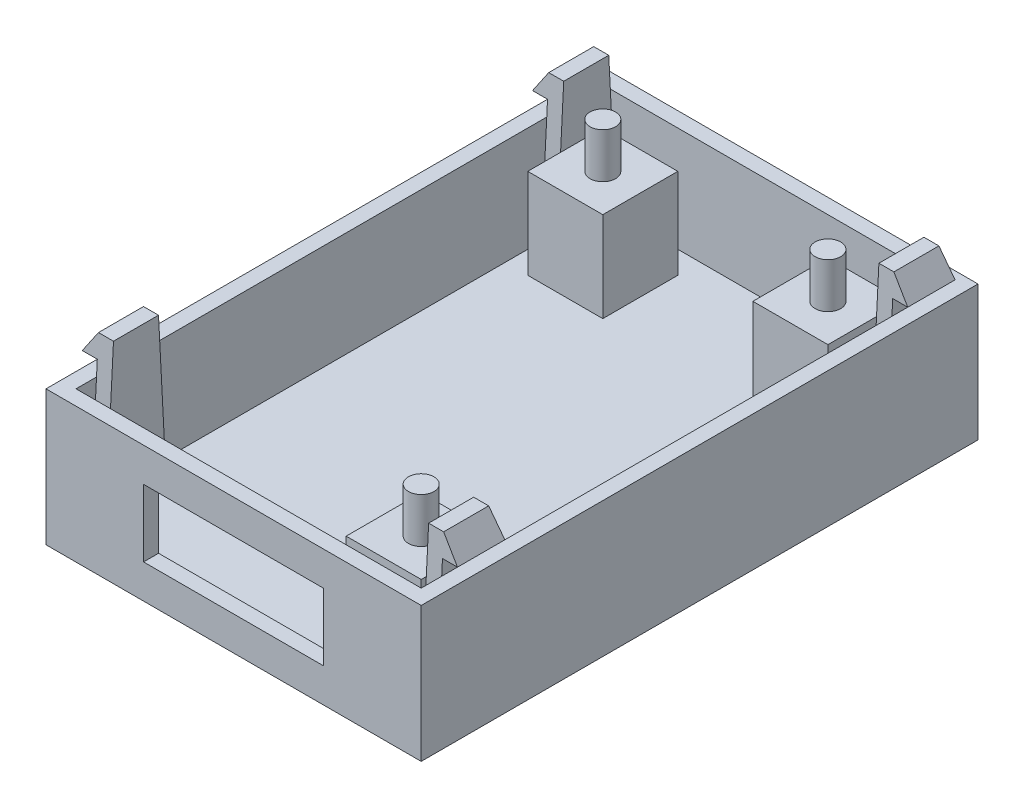
from build123d import *

# Parameters (mm, degrees)
SKETCH2_W           = 25
SKETCH2_H           = 37.1
BOSS_EXTRUDE2_DEPTH = 2
SKETCH2_9_W         = 5
SKETCH2_9_H         = 5
SKETCH2_9_R         = 0.85
BOSS_EXTRUDE4_DEPTH = 6
SKETCH2_10_W        = 25
SKETCH2_10_H        = 37.1
SKETCH2_10_W_2      = 23
SKETCH2_10_H_2      = 35.1
BOSS_EXTRUDE5_DEPTH = 7
SNAP_START          = 1
SNAP_HOOK1_DEPTH    = 1
SNAP_START_2        = 1.525191878
SNAP_HOOK1_2_DEPTH  = 3.157223338
SNAP_START_3        = -1
SNAP_HOOK1_3_DEPTH  = 2
SNAP_HOOK1_4_DEPTH  = 1
LPATTERN1_START     = 1
LPATTERN1_DEPTH     = 1
LPATTERN1_START_2   = 31.525191878
LPATTERN1_2_DEPTH   = 3.157223338
LPATTERN1_START_3   = -1
LPATTERN1_3_DEPTH   = 2
LPATTERN1_4_DEPTH   = 1
SKETCH2_11_R        = 0.85
BOSS_EXTRUDE7_DEPTH = 9
SKETCH9_W           = 12
SKETCH9_H           = 4.478730726
CUT_EXTRUDE2_DEPTH  = 2


with BuildPart() as part:
    # Sketch2 → Boss-Extrude2 (new body)
    with BuildSketch(Plane(origin=(0, 0, 0), x_dir=(1, 0, 0), z_dir=(0, 1, 0))):
        with Locations((12.5, -18.55)):
            Rectangle(SKETCH2_W, SKETCH2_H)
    extrude(amount=-BOSS_EXTRUDE2_DEPTH)

    # Sketch2<9> → Boss-Extrude4 (add)
    # profile 1 of 3: a face of its own
    with BuildSketch(Plane(origin=(0, 0, 0), x_dir=(1, 0, 0), z_dir=(0, 1, 0))):
        with Locations((5, -5)):
            Rectangle(SKETCH2_9_W, SKETCH2_9_H)
        with Locations(Location((5, -5, 0), (0, 0, 270))):
            Circle(SKETCH2_9_R, mode=Mode.SUBTRACT)
    # profile 2 of 3: a face of its own
    with BuildSketch(Plane(origin=(0, 0, 0), x_dir=(1, 0, 0), z_dir=(0, 1, 0))):
        with Locations((20, -32.1)):
            Rectangle(SKETCH2_9_W, SKETCH2_9_H)
        with Locations(Location((20, -32.1, 0), (0, 0, 270))):
            Circle(SKETCH2_9_R, mode=Mode.SUBTRACT)
    # profile 3 of 3: a face of its own
    with BuildSketch(Plane(origin=(0, 0, 0), x_dir=(1, 0, 0), z_dir=(0, 1, 0))):
        with Locations((20, -5)):
            Rectangle(SKETCH2_9_W, SKETCH2_9_H)
        with Locations(Location((20, -5, 0), (0, 0, 270))):
            Circle(SKETCH2_9_R, mode=Mode.SUBTRACT)
    extrude(amount=BOSS_EXTRUDE4_DEPTH)

    # Sketch2<10> → Boss-Extrude5 (add)
    with BuildSketch(Plane(origin=(0, 0, 0), x_dir=(1, 0, 0), z_dir=(0, 1, 0))):
        with Locations((12.5, -18.55)):
            Rectangle(SKETCH2_10_W, SKETCH2_10_H)
        with Locations((12.5, -18.55)):
            Rectangle(SKETCH2_10_W_2, SKETCH2_10_H_2, mode=Mode.SUBTRACT)
    extrude(amount=BOSS_EXTRUDE5_DEPTH)



with BuildPart() as body_2:
    # Snap Hook1: read off the stored shape, not the designer's step
    # Snap Hook1 outline → Snap Hook1 (new body)
    with BuildSketch(Plane.YZ.offset(SNAP_START)):
        Polygon((8, 4.682415216), (8, 1.525191878), (9.5, 1.603803547), (9.5, 4.603803547), align=None)
    snap_hook1 = extrude(amount=SNAP_HOOK1_DEPTH)

    # Snap Hook1 2 outline → Snap Hook1 2 (add)
    with BuildSketch(Plane.XY.offset(SNAP_START_2)):
        Polygon((1, 8), (1, 9.5), (0, 8), align=None)
    snap_hook1_2 = extrude(amount=SNAP_HOOK1_2_DEPTH)

    # Snap Hook1 3 outline → Snap Hook1 3 (cut)
    with BuildSketch(Plane.YZ.offset(SNAP_START_3)):
        Polygon((9.5, 1.603803547), (8, 1.525191878), (11, 1.525191878), (11, 1.682415216), align=None)
        Polygon((11, 4.682415216), (8, 4.682415216), (9.5, 4.603803547), (11, 4.525191878), align=None)
    snap_hook1_3 = extrude(amount=SNAP_HOOK1_3_DEPTH, mode=Mode.SUBTRACT)


with BuildPart() as part_1:
    add(part.part)

    add(body_2.part)  # Snap Hook1 4 merges body 2
    # Snap Hook1 4 outline → Snap Hook1 4 (add)
    with BuildSketch(Plane.YZ.offset(SNAP_START)):
        Polygon((-1, 1.053521865), (0, 1.105929644), (8, 1.525191878), (8, 4.682415216), (0, 5.10167745), (-1, 5.154085229), align=None)
    snap_hook1_4 = extrude(amount=SNAP_HOOK1_4_DEPTH)



with BuildPart() as body_2_2:
    # LPattern1: read off the stored shape, not the designer's step
    # LPattern1 outline → LPattern1 (new body)
    with BuildSketch(Plane.YZ.offset(LPATTERN1_START)):
        Polygon((8, 31.525191878), (9.5, 31.603803547), (9.5, 34.603803547), (8, 34.682415216), align=None)
    lpattern1 = extrude(amount=LPATTERN1_DEPTH)

    # LPattern1 2 outline → LPattern1 2 (add)
    with BuildSketch(Plane.XY.offset(LPATTERN1_START_2)):
        Polygon((1, 8), (1, 9.5), (0, 8), align=None)
    lpattern1_2 = extrude(amount=LPATTERN1_2_DEPTH)

    # LPattern1 3 outline → LPattern1 3 (cut)
    with BuildSketch(Plane.YZ.offset(LPATTERN1_START_3)):
        Polygon((9.5, 31.603803547), (8, 31.525191878), (11, 31.525191878), (11, 31.682415216), align=None)
        Polygon((11, 34.682415216), (8, 34.682415216), (9.5, 34.603803547), (11, 34.525191878), align=None)
    lpattern1_3 = extrude(amount=LPATTERN1_3_DEPTH, mode=Mode.SUBTRACT)


with BuildPart() as part_2:
    add(part_1.part)

    add(body_2_2.part)  # LPattern1 4 merges body 2 2
    # LPattern1 4 outline → LPattern1 4 (add)
    with BuildSketch(Plane.YZ.offset(LPATTERN1_START)):
        Polygon((-1, 31.053521865), (0, 31.105929644), (8, 31.525191878), (8, 34.682415216), (0, 35.10167745), (-1, 35.154085229), align=None)
    lpattern1_4 = extrude(amount=LPATTERN1_4_DEPTH)

    # Mirror1: Snap Hook1, Snap Hook1 2, Snap Hook1 3, Snap Hook1 4, LPattern1, LPattern1 2, LPattern1 3, LPattern1 4 across plane
    add(snap_hook1.mirror(Plane.ZY.offset(-12.5)))
    add(snap_hook1_2.mirror(Plane.ZY.offset(-12.5)))
    add(snap_hook1_3.mirror(Plane.ZY.offset(-12.5)), mode=Mode.SUBTRACT)
    add(snap_hook1_4.mirror(Plane.ZY.offset(-12.5)))
    add(lpattern1.mirror(Plane.ZY.offset(-12.5)))
    add(lpattern1_2.mirror(Plane.ZY.offset(-12.5)))
    add(lpattern1_3.mirror(Plane.ZY.offset(-12.5)), mode=Mode.SUBTRACT)
    add(lpattern1_4.mirror(Plane.ZY.offset(-12.5)))

    # Sketch2<11> → Boss-Extrude7 (add)
    with BuildSketch(Plane(origin=(0, 0, 0), x_dir=(1, 0, 0), z_dir=(0, 1, 0))):
        with Locations(Location((20, -32.1, 0), (0, 0, 270))):
            Circle(SKETCH2_11_R)
        with Locations(Location((5, -5, 0), (0, 0, 270))):
            Circle(SKETCH2_11_R)
        with Locations(Location((20, -5, 0), (0, 0, 270))):
            Circle(SKETCH2_11_R)
    extrude(amount=BOSS_EXTRUDE7_DEPTH)

    # Sketch9 → Cut-Extrude2 (cut)
    with BuildSketch(Plane.XY.offset(37.1)):
        with Locations((12.5, 2.5)):
            Rectangle(SKETCH9_W, SKETCH9_H)
    extrude(amount=-CUT_EXTRUDE2_DEPTH, mode=Mode.SUBTRACT)


solid = part_2.part
